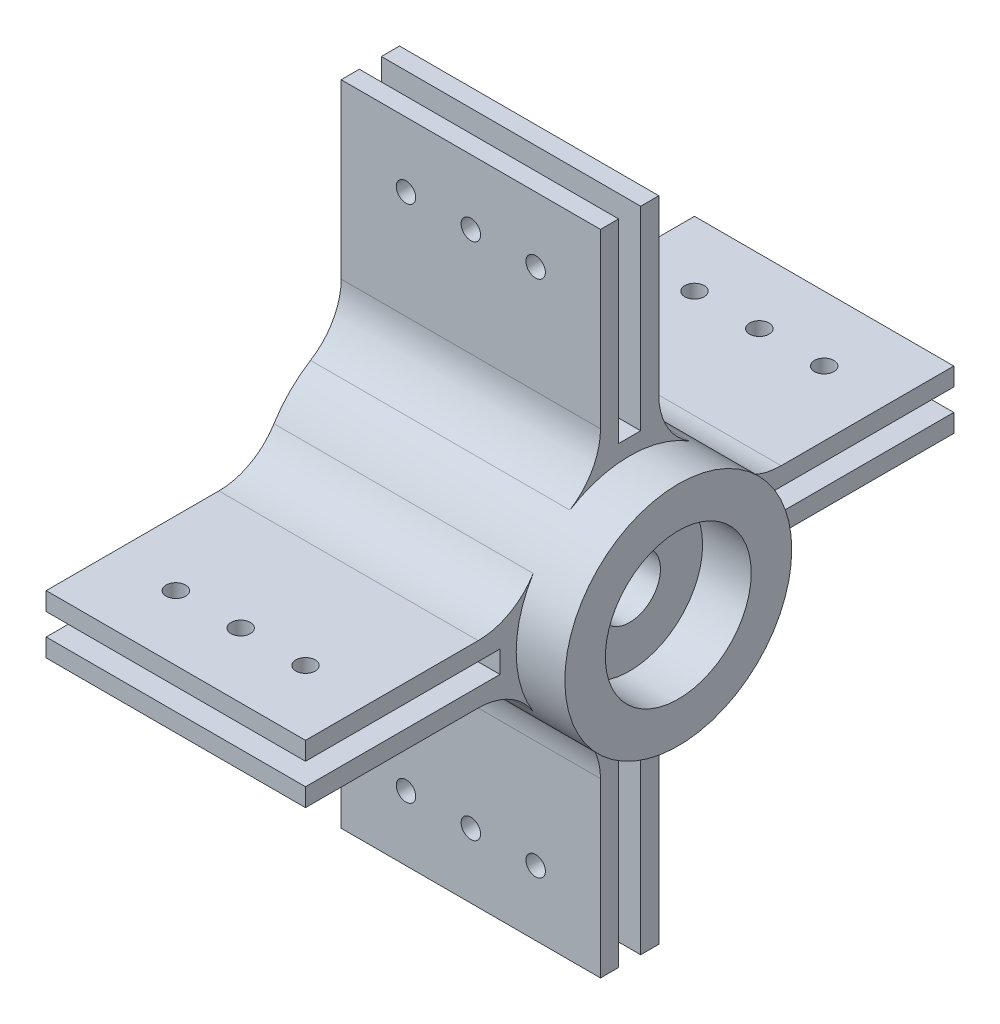
from build123d import *

# Parameters (mm, degrees)
SKETCH1_R                = 17.5
SKETCH1_R_2              = 4.75
MAINBODY_DEPTH           = 40
SKETCH2_R                = 17.5
SKETCH2_R_2              = 11.25
BEARINGHOUSING_DEPTH     = 7.5
SKETCH3_R                = 1.5
MOUNTINGHOLES_DEPTH      = 20
BOSS_EXTRUDE3_DEPTH      = 40
SKETCH6_R                = 1.5
CUT_EXTRUDE2_DEPTH       = 73.389571072
FILLET1_R                = 10
CIRPATTERN1_COUNT        = 4
FILLET1_OF_CIRPATTERN1_R = 10


with BuildPart() as part:
    # Sketch1 → MainBody (new body)
    with BuildSketch(Plane(origin=(0, 0, 0), x_dir=(0, 0, -1), z_dir=(1, 0, 0))):
        Circle(SKETCH1_R)
        Circle(SKETCH1_R_2, mode=Mode.SUBTRACT)
    extrude(amount=MAINBODY_DEPTH)

    # Sketch2 → BearingHousing (add)
    with BuildSketch(Plane(origin=(40, 0, 0), x_dir=(0, 0, -1), z_dir=(1, 0, 0))):
        Circle(SKETCH2_R)
        Circle(SKETCH2_R_2, mode=Mode.SUBTRACT)
    extrude(amount=BEARINGHOUSING_DEPTH)

    # Sketch3 → MountingHoles (cut)
    with BuildSketch(Plane.ZY):
        with Locations((0, 13)):
            Circle(SKETCH3_R)
        with Locations((11.258330249, 6.5)):
            Circle(SKETCH3_R)
        with Locations((11.258330249, -6.5)):
            Circle(SKETCH3_R)
        with Locations((0, -13)):
            Circle(SKETCH3_R)
        with Locations((-11.258330249, -6.5)):
            Circle(SKETCH3_R)
        with Locations((-11.258330249, 6.5)):
            Circle(SKETCH3_R)
    extrude(amount=-MOUNTINGHOLES_DEPTH, mode=Mode.SUBTRACT)

    # Sketch4 → Boss-Extrude3 (add)
    with BuildSketch(Plane.ZY):
        with BuildLine():
            Line((-4.5, 16.911534525), (-4.5, 50))
            Line((-4.5, 50), (-1.7, 50))
            Line((-1.7, 50), (-1.7, 20))
            Line((-1.7, 20), (1.7, 20))
            Line((1.7, 20), (1.7, 50))
            Line((1.7, 50), (4.5, 50))
            Line((4.5, 50), (4.5, 16.911534525))
            ThreePointArc((4.5, 16.911534525), (0, 17.5), (-4.5, 16.911534525))
        make_face()
    boss_extrude3 = extrude(amount=-BOSS_EXTRUDE3_DEPTH)

    # Sketch6 → Cut-Extrude2 (cut, through all)
    with BuildSketch(Plane(origin=(0, 0, -4.5), x_dir=(-1, 0, 0), z_dir=(0, 0, -1))):
        with Locations((-30, 40)):
            Circle(SKETCH6_R)
        with Locations((-20, 40)):
            Circle(SKETCH6_R)
        with Locations((-10, 40)):
            Circle(SKETCH6_R)
    cut_extrude2 = extrude(amount=-CUT_EXTRUDE2_DEPTH, mode=Mode.SUBTRACT)

    # Fillet1
    fillet1_edges = [part.edges().sort_by_distance(p)[0] for p in [
        (20, 16.911534525, -4.5),
        (20, 16.911534525, 4.5),
    ]]
    fillet(fillet1_edges, radius=FILLET1_R)

    # CirPattern1: Boss-Extrude3, Cut-Extrude2 ×4 about axis
    cirpattern1_axis = Axis((40, 0, 0), (-1, 0, 0))
    add([boss_extrude3.rotate(cirpattern1_axis, i * 360 / CIRPATTERN1_COUNT) for i in range(1, CIRPATTERN1_COUNT)])
    add([cut_extrude2.rotate(cirpattern1_axis, i * 360 / CIRPATTERN1_COUNT) for i in range(1, CIRPATTERN1_COUNT)], mode=Mode.SUBTRACT)

    # Fillet1 of CirPattern1
    fillet1_of_cirpattern1_edges = [part.edges().sort_by_distance(p)[0] for p in [
        (20, -4.5, -16.911534525),
        (20, 4.5, -16.911534525),
        (20, -16.911534525, 4.5),
        (20, -16.911534525, -4.5),
        (20, 4.5, 16.911534525),
        (20, -4.5, 16.911534525),
    ]]
    fillet(fillet1_of_cirpattern1_edges, radius=FILLET1_OF_CIRPATTERN1_R)


solid = part.part
